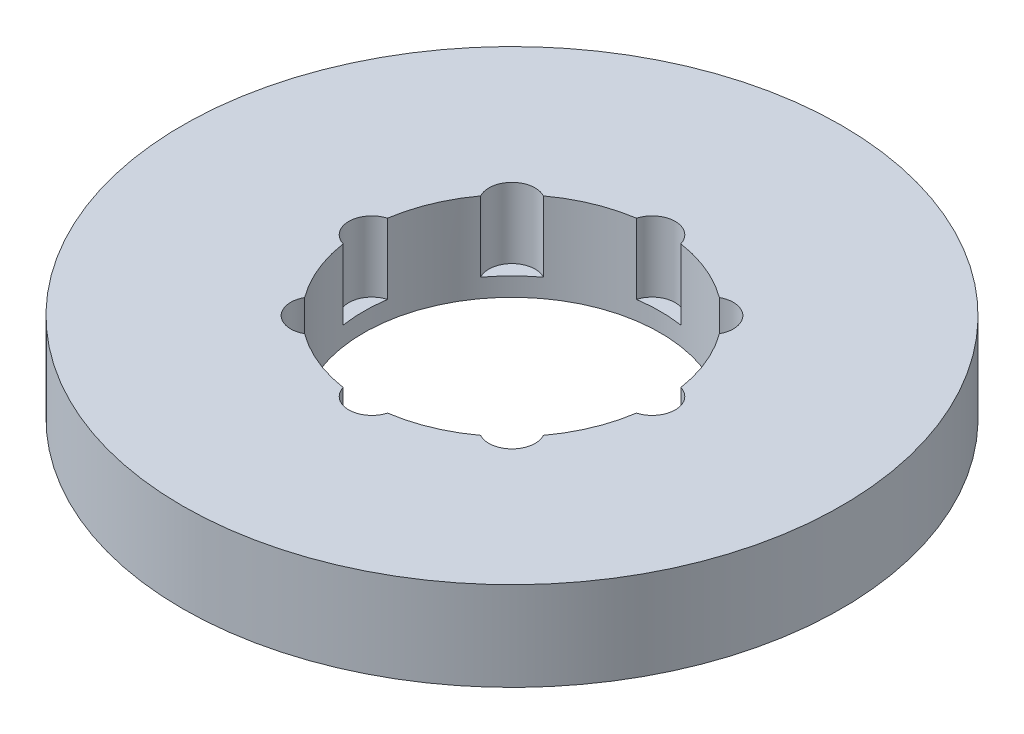
from build123d import *

# Parameters (mm, degrees)
SKETCH1_R           = 100
BOSS_EXTRUDE1_DEPTH = 27
SKETCH2_R           = 45
CUT_EXTRUDE1_DEPTH  = 144.975692393
SKETCH3_R           = 7.011818654
CUT_EXTRUDE2_DEPTH  = 21.352294556
CIRPATTERN1_COUNT   = 8


with BuildPart() as part:
    # Sketch1 → Boss-Extrude1 (new body)
    with BuildSketch(Plane(origin=(0, 0, 0), x_dir=(1, 0, 0), z_dir=(0, 1, 0))):
        Circle(SKETCH1_R)
    extrude(amount=BOSS_EXTRUDE1_DEPTH)

    # Sketch2 → Cut-Extrude1 (cut, through all)
    with BuildSketch(Plane(origin=(0, 0, 0), x_dir=(1, 0, 0), z_dir=(0, 1, 0))):
        Circle(SKETCH2_R)
    extrude(amount=CUT_EXTRUDE1_DEPTH, mode=Mode.SUBTRACT)

    # Sketch3 → Cut-Extrude2 (cut)
    with BuildSketch(Plane(origin=(0, 27, 0), x_dir=(1, 0, 0), z_dir=(0, 1, 0))):
        with Locations((-42.52421084, 0)):
            Circle(SKETCH3_R)
    cut_extrude2 = extrude(amount=-CUT_EXTRUDE2_DEPTH, mode=Mode.SUBTRACT)

    # CirPattern1: Cut-Extrude2 ×8 about axis
    cirpattern1_axis = Axis((0, 0, 0), (0, 1, 0))
    for i in range(1, CIRPATTERN1_COUNT):
        add(cut_extrude2.rotate(cirpattern1_axis, i * 360 / CIRPATTERN1_COUNT), mode=Mode.SUBTRACT)


solid = part.part
